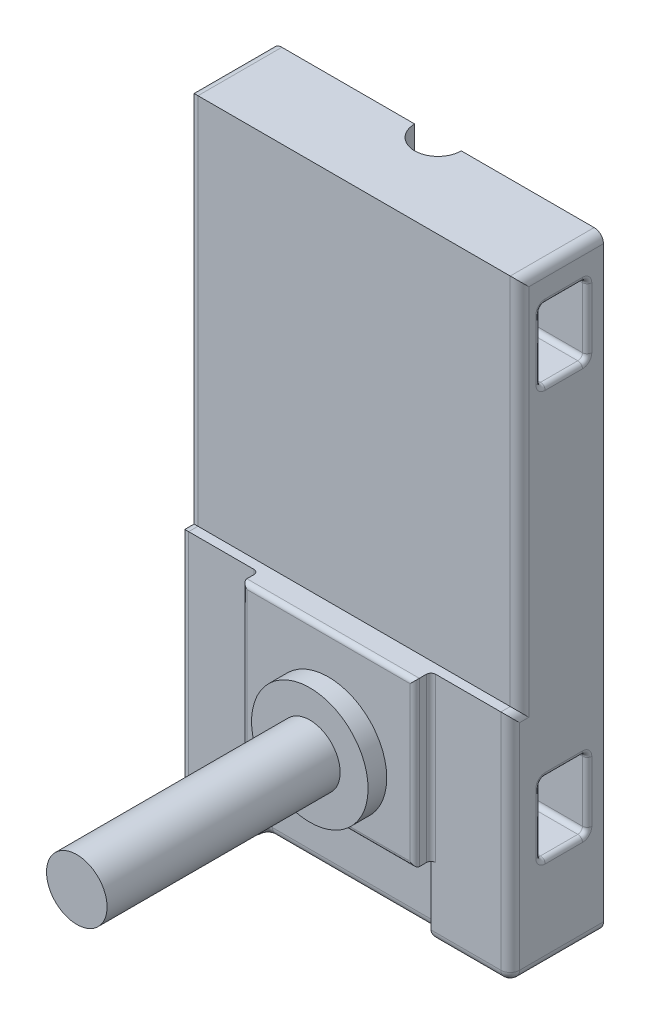
from build123d import *

# Parameters (mm, degrees)
SKETCH1_W           = 710
SKETCH1_H           = 1300
BOSS_EXTRUDE1_DEPTH = 200
SKETCH2_W           = 100
SKETCH2_H           = 150
CUT_EXTRUDE1_DEPTH  = 988
SKETCH4_W           = 370
SKETCH4_H           = 20
CUT_EXTRUDE2_DEPTH  = 150
SKETCH5_W           = 370
SKETCH5_H           = 35
BOSS_EXTRUDE2_DEPTH = 350
SKETCH6_R           = 125
BOSS_EXTRUDE3_DEPTH = 40
SKETCH7_R           = 65
CUT_EXTRUDE3_DEPTH  = 126
FILLET4_R           = 10
FILLET5_R           = 10
SKETCH8_W           = 710
SKETCH8_H           = 20
CUT_EXTRUDE6_DEPTH  = 800
SKETCH9_R           = 50
CUT_EXTRUDE7_DEPTH  = 1563
FILLET6_R           = 20
FILLET7_R           = 10
FILLET8_R           = 10
SKETCH10_R          = 65
BOSS_EXTRUDE4_DEPTH = 500


with BuildPart() as part:
    # Sketch1 → Boss-Extrude1 (new body)
    with BuildSketch(Plane.XY):
        with Locations((355, 650)):
            Rectangle(SKETCH1_W, SKETCH1_H)
    extrude(amount=BOSS_EXTRUDE1_DEPTH)

    # Sketch2 → Cut-Extrude1 (cut)
    with BuildSketch(Plane(origin=(710, 0, 0), x_dir=(0, 0, -1), z_dir=(1, 0, 0))):
        with Locations((-85, 275)):
            Rectangle(SKETCH2_W, SKETCH2_H)
        with Locations((-85, 1155)):
            Rectangle(SKETCH2_W, SKETCH2_H)
    extrude(amount=-CUT_EXTRUDE1_DEPTH, mode=Mode.SUBTRACT)

    # Sketch4 → Cut-Extrude2 (cut)
    with BuildSketch(Plane.XZ):
        with Locations((355, 190)):
            Rectangle(SKETCH4_W, SKETCH4_H)
    extrude(amount=-CUT_EXTRUDE2_DEPTH, mode=Mode.SUBTRACT)

    # Sketch5 → Boss-Extrude2 (add)
    with BuildSketch(Plane.XZ.offset(-150)):
        with Locations((355, 217.5)):
            Rectangle(SKETCH5_W, SKETCH5_H)
    extrude(amount=-BOSS_EXTRUDE2_DEPTH)

    # Sketch6 → Boss-Extrude3 (add)
    with BuildSketch(Plane.XY.offset(235)):
        with Locations((355, 290)):
            Circle(SKETCH6_R)
    extrude(amount=BOSS_EXTRUDE3_DEPTH)

    # Sketch7 → Cut-Extrude3 (cut)
    with BuildSketch(Plane.XY.offset(275)):
        with Locations((355, 290)):
            Circle(SKETCH7_R)
    extrude(amount=-CUT_EXTRUDE3_DEPTH, mode=Mode.SUBTRACT)

    # Fillet4
    fillet4_edges = [part.edges().sort_by_distance(p)[0] for p in [
        (170, 75, 180),
        (355, 150, 180),
        (540, 75, 180),
    ]]
    fillet(fillet4_edges, radius=FILLET4_R)

    # Fillet5
    fillet5_edges = [part.edges().sort_by_distance(p)[0] for p in [
        (0, 275, 35),
        (355, 350, 35),
        (0, 200, 85),
        (355, 200, 35),
        (0, 275, 135),
        (355, 200, 135),
        (0, 350, 85),
        (355, 350, 135),
        (710, 275, 35),
        (710, 350, 85),
        (710, 275, 135),
        (710, 200, 85),
        (0, 1155, 35),
        (355, 1230, 35),
        (0, 1080, 85),
        (355, 1080, 35),
        (0, 1155, 135),
        (355, 1080, 135),
        (0, 1230, 85),
        (355, 1230, 135),
        (710, 1155, 35),
        (710, 1230, 85),
        (710, 1155, 135),
        (710, 1080, 85),
    ]]
    fillet(fillet5_edges, radius=FILLET5_R)

    # Sketch8 → Cut-Extrude6 (cut)
    with BuildSketch(Plane(origin=(0, 1300, 0), x_dir=(1, 0, 0), z_dir=(0, 1, 0))):
        with Locations((355, -190)):
            Rectangle(SKETCH8_W, SKETCH8_H)
    extrude(amount=-CUT_EXTRUDE6_DEPTH, mode=Mode.SUBTRACT)

    # Sketch9 → Cut-Extrude7 (cut)
    with BuildSketch(Plane.XZ):
        with Locations((355, 0)):
            Circle(SKETCH9_R)
    extrude(amount=-CUT_EXTRUDE7_DEPTH, mode=Mode.SUBTRACT)

    # Fillet6
    # the kernel refuses this fillet: 20 mm, written as the material it takes off along each edge
    with BuildSketch(Plane(origin=(690, 20, 180), x_dir=(0, 0, 1), z_dir=(1, 0, 0))) as fillet6_piece_1_section:
        Polygon((0, 0), (FILLET6_R, 0), (FILLET6_R, FILLET6_R), (0, FILLET6_R), align=None)
    fillet6_piece_1 = extrude(amount=FILLET6_R, mode=Mode.PRIVATE)
    fillet6_piece_1 = fillet6_piece_1 - Plane(origin=(690, 20, 180), x_dir=(0, 0.7071067811865475, -0.7071067811865475), z_dir=(1, 0, 0)) * Sphere(FILLET6_R, mode=Mode.PRIVATE)
    add(fillet6_piece_1, mode=Mode.SUBTRACT)
    with BuildSketch(Plane(origin=(20, 20, 180), x_dir=(0, 0, 1), z_dir=(-1, 0, 0))) as fillet6_piece_2_section:
        Polygon((0, 0), (FILLET6_R, 0), (FILLET6_R, -FILLET6_R), (0, -FILLET6_R), align=None)
    fillet6_piece_2 = extrude(amount=FILLET6_R, mode=Mode.PRIVATE)
    fillet6_piece_2 = fillet6_piece_2 - Plane(origin=(20, 20, 180), x_dir=(0, 0.7071067811865475, -0.7071067811865475), z_dir=(-1, 0, 0)) * Sphere(FILLET6_R, mode=Mode.PRIVATE)
    add(fillet6_piece_2, mode=Mode.SUBTRACT)
    with BuildSketch(Plane(origin=(180, 0, 190), x_dir=(0, 0, -1), z_dir=(1, 0, 0))) as fillet6_piece_3:
        with BuildLine():
            CenterArc((10 + FILLET6_R, FILLET6_R), FILLET6_R, 180, 90)
            Line((10, FILLET6_R), (10, 0))
            Line((10, 0), (10 + FILLET6_R, 0))
        make_face()
    revolve(axis=Axis((180, 0, 190), (0, 1, 0)), revolution_arc=90, mode=Mode.SUBTRACT)
    with BuildSketch(Plane(origin=(530, 0, 190), x_dir=(1, 0, 0), z_dir=(0, 0, 1))) as fillet6_piece_4:
        with BuildLine():
            CenterArc((10 + FILLET6_R, FILLET6_R), FILLET6_R, 180, 90)
            Line((10, FILLET6_R), (10, 0))
            Line((10, 0), (10 + FILLET6_R, 0))
        make_face()
    revolve(axis=Axis((530, 0, 190), (0, 1, 0)), revolution_arc=90, mode=Mode.SUBTRACT)
    with BuildSketch(Plane(origin=(710, 1350, 180), x_dir=(0, 0, -1), z_dir=(0, -1, 0)), Plane(origin=(0, 1350, 180), x_dir=(1, 0, 0), z_dir=(0, -1, 0))) as fillet6_piece_5:
        with BuildLine():
            CenterArc((FILLET6_R, -FILLET6_R), FILLET6_R, 90, 90)
            Line((0, -FILLET6_R), (0, 0))
            Line((0, 0), (FILLET6_R, 0))
        make_face()
    extrude(amount=850, mode=Mode.SUBTRACT)
    with BuildSketch(Plane(origin=(710, 500, 250), x_dir=(0, -1, 0), z_dir=(0, 0, -1))) as fillet6_piece_6:
        with BuildLine():
            CenterArc((FILLET6_R, FILLET6_R), FILLET6_R, 180, 90)
            Line((0, FILLET6_R), (0, 0))
            Line((0, 0), (FILLET6_R, 0))
        make_face()
    extrude(amount=70, mode=Mode.SUBTRACT)
    with BuildSketch(Plane(origin=(0, 500, 180), x_dir=(1, 0, 0), z_dir=(0, 0, 1))) as fillet6_piece_7:
        with BuildLine():
            CenterArc((FILLET6_R, -FILLET6_R), FILLET6_R, 90, 90)
            Line((0, -FILLET6_R), (0, 0))
            Line((0, 0), (FILLET6_R, 0))
        make_face()
    extrude(amount=70, mode=Mode.SUBTRACT)
    with BuildSketch(Plane(origin=(710, 20, 200), x_dir=(0, 0, -1), z_dir=(0, 1, 0)), Plane(origin=(0, 550, 200), x_dir=(0, 0, -1), z_dir=(0, -1, 0))) as fillet6_piece_8:
        with BuildLine():
            CenterArc((FILLET6_R, FILLET6_R), FILLET6_R, 180, 90)
            Line((0, FILLET6_R), (0, 0))
            Line((0, 0), (FILLET6_R, 0))
        make_face()
    extrude(amount=530, mode=Mode.SUBTRACT)
    with BuildSketch(Plane(origin=(490, 0, 200), x_dir=(0, 1, 0), z_dir=(1, 0, 0))) as fillet6_piece_9:
        with BuildLine():
            CenterArc((FILLET6_R, -FILLET6_R), FILLET6_R, 90, 90)
            Line((0, -FILLET6_R), (0, 0))
            Line((0, 0), (FILLET6_R, 0))
        make_face()
    extrude(amount=200, mode=Mode.SUBTRACT)
    with BuildSketch(Plane(origin=(20, 0, 200), x_dir=(0, 0, -1), z_dir=(1, 0, 0))) as fillet6_piece_10:
        with BuildLine():
            CenterArc((FILLET6_R, FILLET6_R), FILLET6_R, 180, 90)
            Line((0, FILLET6_R), (0, 0))
            Line((0, 0), (FILLET6_R, 0))
        make_face()
    extrude(amount=200, mode=Mode.SUBTRACT)
    with BuildSketch(Plane(origin=(530, 0, 180), x_dir=(0, 0, -1), z_dir=(-1, 0, 0))) as fillet6_piece_11:
        with BuildLine():
            CenterArc((FILLET6_R, -FILLET6_R), FILLET6_R, 90, 90)
            Line((0, -FILLET6_R), (0, 0))
            Line((0, 0), (FILLET6_R, 0))
        make_face()
    extrude(amount=350, mode=Mode.SUBTRACT)
    with BuildSketch(Plane(origin=(710, 1300, -50), x_dir=(0, -1, 0), z_dir=(0, 0, 1)), Plane(origin=(0, 1300, -50), x_dir=(1, 0, 0), z_dir=(0, 0, 1))) as fillet6_piece_12:
        with BuildLine():
            CenterArc((FILLET6_R, -FILLET6_R), FILLET6_R, 90, 90)
            Line((0, -FILLET6_R), (0, 0))
            Line((0, 0), (FILLET6_R, 0))
        make_face()
    extrude(amount=280, mode=Mode.SUBTRACT)
    with BuildSketch(Plane(origin=(0, 0, -50), x_dir=(1, 0, 0), z_dir=(0, 0, 1)), Plane(origin=(710, 0, -50), x_dir=(0, 1, 0), z_dir=(0, 0, 1))) as fillet6_piece_13:
        with BuildLine():
            CenterArc((FILLET6_R, FILLET6_R), FILLET6_R, 180, 90)
            Line((0, FILLET6_R), (0, 0))
            Line((0, 0), (FILLET6_R, 0))
        make_face()
    extrude(amount=230, mode=Mode.SUBTRACT)
    with BuildSketch(Plane(origin=(540, 0, 250), x_dir=(1, 0, 0), z_dir=(0, 0, -1)), Plane(origin=(170, 0, 190), x_dir=(-1, 0, 0), z_dir=(0, 0, 1))) as fillet6_piece_14:
        with BuildLine():
            CenterArc((FILLET6_R, -FILLET6_R), FILLET6_R, 90, 90)
            Line((0, -FILLET6_R), (0, 0))
            Line((0, 0), (FILLET6_R, 0))
        make_face()
    extrude(amount=60, mode=Mode.SUBTRACT)
    with BuildSketch(Plane(origin=(710, 1350, 180), x_dir=(0, 0, -1), z_dir=(0, -1, 0))) as fillet6_piece_15a_section:
        with BuildLine():
            CenterArc((FILLET6_R, -FILLET6_R), FILLET6_R, 90, 90)
            Line((0, -FILLET6_R), (0, 0))
            Line((0, 0), (FILLET6_R, 0))
        make_face()
    fillet6_piece_15a = extrude(amount=900, mode=Mode.PRIVATE)
    fillet6_piece_15a = split(fillet6_piece_15a, bisect_by=Plane(origin=(705.472097715, 500, 175.472097715), z_dir=(0, -1, 0)), keep=Keep.TOP, mode=Mode.PRIVATE)
    with BuildSketch(Plane(origin=(710, 500, 250), x_dir=(0, -1, 0), z_dir=(0, 0, -1))) as fillet6_piece_15b_section:
        with BuildLine():
            CenterArc((FILLET6_R, FILLET6_R), FILLET6_R, 180, 90)
            Line((0, FILLET6_R), (0, 0))
            Line((0, 0), (FILLET6_R, 0))
        make_face()
    fillet6_piece_15b = extrude(amount=120, mode=Mode.PRIVATE)
    fillet6_piece_15b = split(fillet6_piece_15b, bisect_by=Plane(origin=(705.472097715, 495.472097715, 180), z_dir=(0, 0, -1)), keep=Keep.TOP, mode=Mode.PRIVATE)
    fillet6_piece_15 = fillet6_piece_15a & fillet6_piece_15b
    add(fillet6_piece_15, mode=Mode.SUBTRACT)
    with BuildSketch(Plane(origin=(0, 1350, 180), x_dir=(1, 0, 0), z_dir=(0, -1, 0))) as fillet6_piece_16a_section:
        with BuildLine():
            CenterArc((FILLET6_R, -FILLET6_R), FILLET6_R, 90, 90)
            Line((0, -FILLET6_R), (0, 0))
            Line((0, 0), (FILLET6_R, 0))
        make_face()
    fillet6_piece_16a = extrude(amount=900, mode=Mode.PRIVATE)
    fillet6_piece_16a = split(fillet6_piece_16a, bisect_by=Plane(origin=(4.527902285, 500, 175.472097715), z_dir=(0, -1, 0)), keep=Keep.TOP, mode=Mode.PRIVATE)
    with BuildSketch(Plane(origin=(0, 500, 130), x_dir=(1, 0, 0), z_dir=(0, 0, 1))) as fillet6_piece_16b_section:
        with BuildLine():
            CenterArc((FILLET6_R, -FILLET6_R), FILLET6_R, 90, 90)
            Line((0, -FILLET6_R), (0, 0))
            Line((0, 0), (FILLET6_R, 0))
        make_face()
    fillet6_piece_16b = extrude(amount=120, mode=Mode.PRIVATE)
    fillet6_piece_16b = split(fillet6_piece_16b, bisect_by=Plane(origin=(4.527902285, 495.472097715, 180), z_dir=(0, 0, -1)), keep=Keep.TOP, mode=Mode.PRIVATE)
    fillet6_piece_16 = fillet6_piece_16a & fillet6_piece_16b
    add(fillet6_piece_16, mode=Mode.SUBTRACT)

    # Fillet7
    fillet7_edges = [part.edges().sort_by_distance(p)[0] for p in [
        (170, 325, 200),
        (540, 325, 200),
    ]]
    fillet(fillet7_edges, radius=FILLET7_R)

    # Fillet8
    fillet8_edges = [part.edges().sort_by_distance(p)[0] for p in [
        (355, 500, 235),
        (170, 325, 235),
        (540, 325, 235),
        (355, 150, 235),
    ]]
    fillet(fillet8_edges, radius=FILLET8_R)


with BuildPart() as body_2:
    # Sketch10 → Boss-Extrude4 (new body)
    with BuildSketch(Plane.XY.offset(275)):
        with Locations((355, 290)):
            Circle(SKETCH10_R)
    extrude(amount=BOSS_EXTRUDE4_DEPTH)


solid = Compound([part.part, body_2.part])
